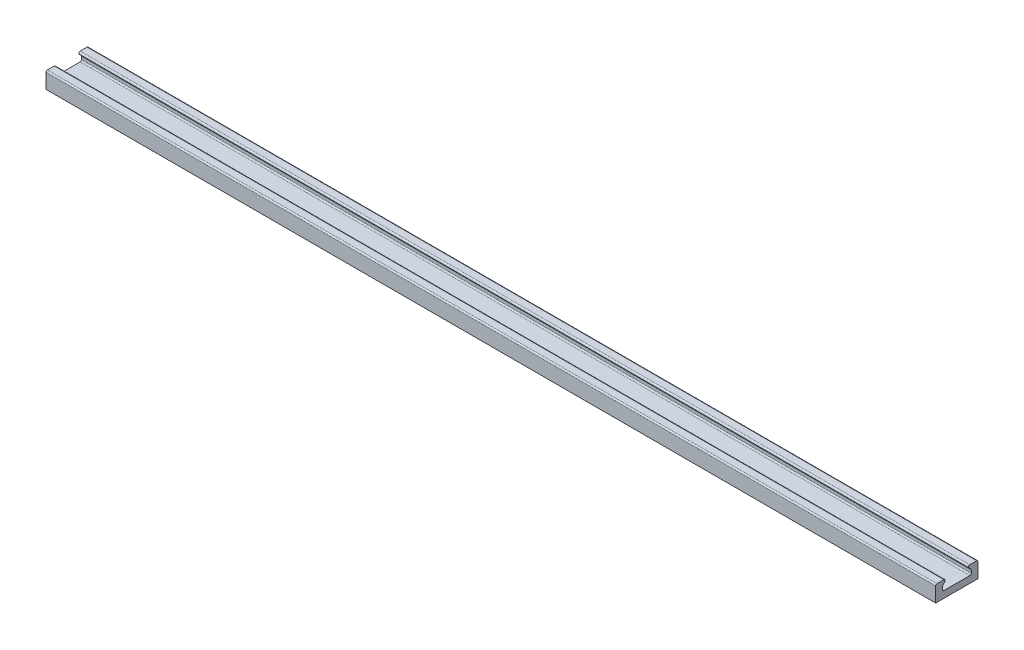
from build123d import *

# Parameters (mm, degrees)
BOSS_EXTRUDE1_DEPTH = 330.2


with BuildPart() as part:
    # Sketch1 → Boss-Extrude1 (new body)
    with BuildSketch(Plane(origin=(0, 0, 0), x_dir=(0, 0, -1), z_dir=(1, 0, 0))):
        with BuildLine():
            Line((7.85, 0), (-7.85, 0))
            Line((-7.85, 0), (-7.85, 5.5))
            ThreePointArc((-7.85, 5.5), (-7.703553391, 5.853553391), (-7.35, 6))
            Line((-7.35, 6), (-4.807106781, 6))
            ThreePointArc((-4.807106781, 6), (-4.345167015, 5.691341716), (-4.453553391, 5.146446609))
            Line((-4.453553391, 5.146446609), (-5.203553391, 4.396446609))
            ThreePointArc((-5.203553391, 4.396446609), (-5.311939766, 4.234234935), (-5.35, 4.042893219))
            Line((-5.35, 4.042893219), (-5.35, 3))
            ThreePointArc((-5.35, 3), (-5.203553391, 2.646446609), (-4.85, 2.5))
            Line((-4.85, 2.5), (4.85, 2.5))
            ThreePointArc((4.85, 2.5), (5.203553391, 2.646446609), (5.35, 3))
            Line((5.35, 3), (5.35, 4.042893219))
            ThreePointArc((5.35, 4.042893219), (5.311939766, 4.234234935), (5.203553391, 4.396446609))
            Line((5.203553391, 4.396446609), (4.453553391, 5.146446609))
            ThreePointArc((4.453553391, 5.146446609), (4.345167015, 5.691341716), (4.807106781, 6))
            Line((4.807106781, 6), (7.35, 6))
            ThreePointArc((7.35, 6), (7.703553391, 5.853553391), (7.85, 5.5))
            Line((7.85, 5.5), (7.85, 0))
        make_face()
    extrude(amount=BOSS_EXTRUDE1_DEPTH)


solid = part.part
